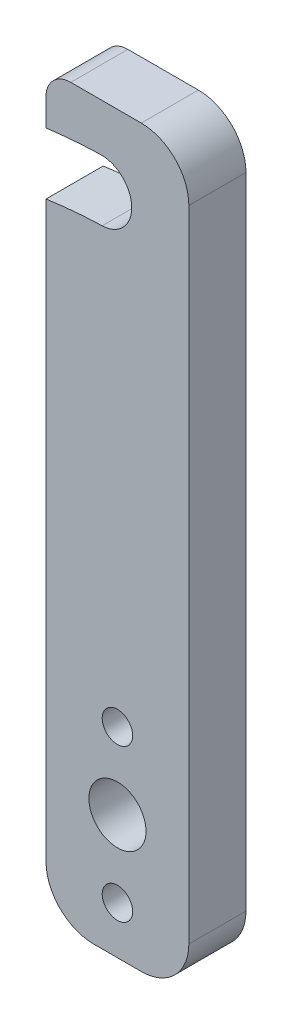
from build123d import *

# Parameters (mm, degrees)
ESBO_O1_R                = 1.6
ESBO_O1_R_2              = 3
RESSALTO_EXTRUS_O1_DEPTH = 6
FILETE1_R                = 5
FILETE2_R                = 2.6


with BuildPart() as part:
    # Esboço1 → Ressalto-extrusão1 (new body)
    with BuildSketch(Plane.XY):
        with BuildLine():
            Line((-7.5, 26.678233731), (-7.5, -38.58638145))
            Line((-7.5, -38.58638145), (7.5, -38.58638145))
            Line((7.5, -38.58638145), (7.5, 38.58638145))
            Line((7.5, 38.58638145), (-7.5, 38.58638145))
            Line((-7.5, 38.58638145), (-7.5, 33.136612343))
            ThreePointArc((-7.5, 33.136612343), (-4.653230591, 33.430458901), (-1.795586451, 33.58638145))
            ThreePointArc((-1.795586451, 33.58638145), (1.5, 30.484912453), (-1.601468997, 27.189326002))
            ThreePointArc((-1.601468997, 27.189326002), (-4.557903938, 27.016522573), (-7.5, 26.678233731))
        make_face()
        with Locations((0, -33.58638145)):
            Circle(ESBO_O1_R, mode=Mode.SUBTRACT)
        with Locations((0, -25.58638145)):
            Circle(ESBO_O1_R_2, mode=Mode.SUBTRACT)
        with Locations((0, -17.58638145)):
            Circle(ESBO_O1_R, mode=Mode.SUBTRACT)
    extrude(amount=RESSALTO_EXTRUS_O1_DEPTH)

    # Filete1
    filete1_edges = [part.edges().sort_by_distance(p)[0] for p in [
        (-7.5, -38.58638145, 3),
        (7.5, -38.58638145, 3),
        (7.5, 38.58638145, 3),
    ]]
    fillet(filete1_edges, radius=FILETE1_R)

    # Filete2
    filete2_edges = [part.edges().sort_by_distance(p)[0] for p in [
        (-7.5, 38.58638145, 3),
    ]]
    fillet(filete2_edges, radius=FILETE2_R)


solid = part.part
